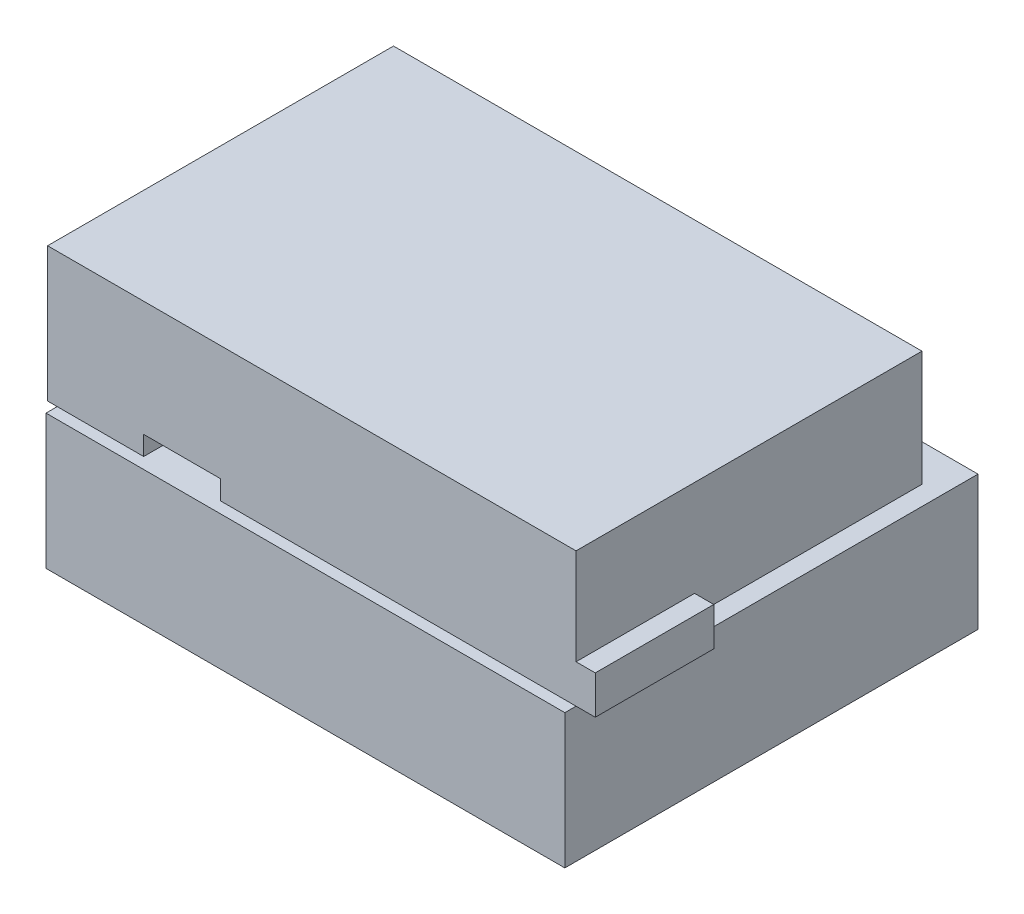
from build123d import *

# Parameters (mm, degrees)
SKETCH2_W                   = 54
SKETCH2_H                   = 43
BOSS_EXTRUDE1_BATTERY_DEPTH = 14
SKETCH4_W                   = 55
SKETCH4_H                   = 36
BOSS_EXTRUDE2_CIRCUIT_DEPTH = 14
SKETCH11_W                  = 27
SKETCH11_H                  = 2
CUT_EXTRUDE2_DEPTH          = 55
SKETCH12_W                  = 12.333333333
SKETCH12_H                  = 4
BOSS_EXTRUDE1_DEPTH         = 2
SKETCH8_W                   = 8
SKETCH8_H                   = 2
CUT_EXTRUDE3_DEPTH          = 10


with BuildPart() as part:
    # Sketch2 → Boss-Extrude1-Battery (new body)
    with BuildSketch(Plane(origin=(0, 0, 0), x_dir=(1, 0, 0), z_dir=(0, 1, 0))):
        Rectangle(SKETCH2_W, SKETCH2_H)
    extrude(amount=BOSS_EXTRUDE1_BATTERY_DEPTH)


with BuildPart() as body_2:
    # Sketch4 → Boss-Extrude2-Circuit (new body)
    with BuildSketch(Plane(origin=(0, 15, 0), x_dir=(1, 0, 0), z_dir=(0, 1, 0))):
        with Locations((0.5, -3.333333333)):
            Rectangle(SKETCH4_W, SKETCH4_H)
    extrude(amount=BOSS_EXTRUDE2_CIRCUIT_DEPTH)

    # Sketch11 → Cut-Extrude2 (cut)
    with BuildSketch(Plane(origin=(28, 0, 0), x_dir=(0, 0, -1), z_dir=(1, 0, 0))):
        with Locations((1.166666667, 16)):
            Rectangle(SKETCH11_W, SKETCH11_H)
    extrude(amount=-CUT_EXTRUDE2_DEPTH, mode=Mode.SUBTRACT)

    # Sketch12 → Boss-Extrude1 (add)
    with BuildSketch(Plane(origin=(28, 0, 0), x_dir=(0, 0, -1), z_dir=(1, 0, 0))):
        with Locations((-15.166666667, 17)):
            Rectangle(SKETCH12_W, SKETCH12_H)
    extrude(amount=BOSS_EXTRUDE1_DEPTH)

    # Sketch8 → Cut-Extrude3 (cut)
    with BuildSketch(Plane.XY.offset(21.333333333)):
        with Locations((-13, 16)):
            Rectangle(SKETCH8_W, SKETCH8_H)
    extrude(amount=-CUT_EXTRUDE3_DEPTH, mode=Mode.SUBTRACT)


solid = Compound([part.part, body_2.part])
